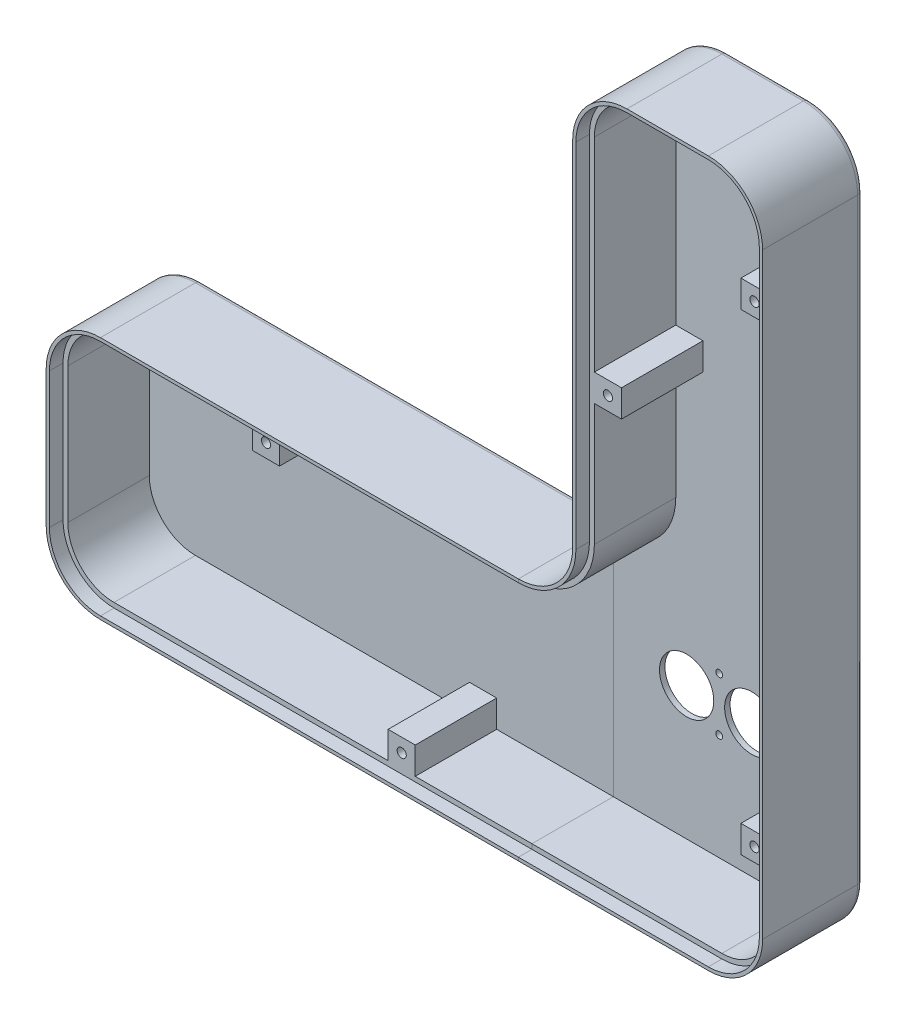
from build123d import *

# Parameters (mm, degrees)
BOX_EXTRUDE_DEPTH                 = 37
SHELL1_T                          = -1.2
SHELL1_THICKNESS_2_DEPTH          = 30.8
SHELL2_START                      = -35
SHELL2_DEPTH                      = 30
SKETCH2_W                         = 10
SKETCH2_H                         = 10
SQUARES_EXTRUDE_DEPTH             = 30
SQUARES_M3_CLEARANCE_HOLES_D      = 3.4
SQUARES_M3_CLEARANCE_HOLES_DEPTH  = 46
SQUARES_M3_CLEARANCE_HOLES_TIP    = 1.021463052
SKETCH5_R                         = 3
SQUARESCREWS_CUT_EXTRUDE_DEPTH    = 12
FILLET1_R                         = 2
DOVETAIL_M18_CLEARANCE_HOLE_D     = 20
DOVETAIL_M18_CLEARANCE_HOLE_DEPTH = 46
DOVETAIL_M18_CLEARANCE_HOLE_TIP   = 6.00860619
DOVETAIL_M3_CLEARANCE_HOLE_D      = 2.5
DOVETAIL_M3_CLEARANCE_HOLE_DEPTH  = 46
DOVETAIL_M3_CLEARANCE_HOLE_TIP    = 0.751075774


# Read off the part's stored shape, not the designer's step: Shell2
with BuildPart() as part:
    # Sketch1 → Box-Extrude (new body)
    with BuildSketch(Plane.XY):
        with BuildLine():
            Line((189.366428174, 55.055128635), (189.366428174, -25.682309997))
            ThreePointArc((189.366428174, -25.682309997), (183.508563798, -39.824445621), (169.366428174, -45.682309997))
            Line((169.366428174, -45.682309997), (0, -45.682309997))
            Line((0, -45.682309997), (-54.633571826, -45.682309997))
            ThreePointArc((-54.633571826, -45.682309997), (-68.77570745, -39.824445621), (-74.633571826, -25.682309997))
            Line((-74.633571826, -25.682309997), (-74.633571826, 24.317690003))
            ThreePointArc((-74.633571826, 24.317690003), (-68.77570745, 38.459825627), (-54.633571826, 44.317690003))
            Line((-54.633571826, 44.317690003), (99.366428174, 44.317690003))
            ThreePointArc((99.366428174, 44.317690003), (109.72858945, 47.211386671), (117.092255571, 55.055128635))
            ThreePointArc((117.092255571, 55.055128635), (118.789565767, 59.548861422), (119.366428174, 64.317690003))
            Line((119.366428174, 64.317690003), (119.366428174, 194.317690003))
            ThreePointArc((119.366428174, 194.317690003), (125.22429255, 208.459825627), (139.366428174, 214.317690003))
            Line((139.366428174, 214.317690003), (169.366428174, 214.317690003))
            ThreePointArc((169.366428174, 214.317690003), (183.508563798, 208.459825627), (189.366428174, 194.317690003))
            Line((189.366428174, 194.317690003), (189.366428174, 55.055128635))
        make_face()
    extrude(amount=-BOX_EXTRUDE_DEPTH)

    # Shell1
    shell1_openings = [part.faces().sort_by_distance(p)[0] for p in [
        (90.029023859, 42.316719336, 0),
    ]]
    offset(amount=SHELL1_T, openings=shell1_openings, kind=Kind.INTERSECTION)

    # Shell1 thickness 2 face (on inner face of the shell) → Shell1 thickness 2 (add)
    with BuildSketch(Plane(origin=(90.047419114, 41.98561552, -35.8), x_dir=(-1, 0, 0), z_dir=(0, 0, -1))):
        with BuildLine():
            Line((-9.31900906, 1.132074483), (144.68099094, 1.132074483))
            ThreePointArc((144.68099094, 1.132074483), (157.974598426, -4.374318031), (163.48099094, -17.667925517))
            Line((163.48099094, -17.667925517), (163.48099094, -67.667925517))
            ThreePointArc((163.48099094, -67.667925517), (157.974598426, -80.961533003), (144.68099094, -86.467925517))
            Line((144.68099094, -86.467925517), (-79.31900906, -86.467925517))
            ThreePointArc((-79.31900906, -86.467925517), (-92.612616546, -80.961533003), (-98.11900906, -67.667925517))
            Line((-98.11900906, -67.667925517), (-98.11900906, 152.332074483))
            ThreePointArc((-98.11900906, 152.332074483), (-92.612616546, 165.625681969), (-79.31900906, 171.132074483))
            Line((-79.31900906, 171.132074483), (-49.31900906, 171.132074483))
            ThreePointArc((-49.31900906, 171.132074483), (-36.025401574, 165.625681969), (-30.51900906, 152.332074483))
            Line((-30.51900906, 152.332074483), (-30.51900906, 22.332074483))
            ThreePointArc((-30.51900906, 22.332074483), (-24.309672821, 7.341410722), (-9.31900906, 1.132074483))
        make_face()
    extrude(amount=-SHELL1_THICKNESS_2_DEPTH)

    # Shell2 outline → Shell2 (cut)
    with BuildSketch(Plane.XY.offset(SHELL2_START)):
        with BuildLine():
            Line((-54.633571826, -42.682309997), (169.366428174, -42.682309997))
            ThreePointArc((169.366428174, -42.682309997), (181.387243454, -37.703125277), (186.366428174, -25.682309997))
            Line((186.366428174, -25.682309997), (186.366428174, 194.317690003))
            ThreePointArc((186.366428174, 194.317690003), (181.387243454, 206.338505283), (169.366428174, 211.317690003))
            Line((169.366428174, 211.317690003), (139.366428174, 211.317690003))
            ThreePointArc((139.366428174, 211.317690003), (127.345612894, 206.338505283), (122.366428174, 194.317690003))
            Line((122.366428174, 194.317690003), (122.366428174, 64.317690003))
            ThreePointArc((122.366428174, 64.317690003), (115.629884141, 48.054234036), (99.366428174, 41.317690003))
            Line((99.366428174, 41.317690003), (-54.633571826, 41.317690003))
            ThreePointArc((-54.633571826, 41.317690003), (-66.654387106, 36.338505283), (-71.633571826, 24.317690003))
            Line((-71.633571826, 24.317690003), (-71.633571826, -25.682309997))
            ThreePointArc((-71.633571826, -25.682309997), (-66.654387106, -37.703125277), (-54.633571826, -42.682309997))
        make_face()
    extrude(amount=SHELL2_DEPTH, mode=Mode.SUBTRACT)

    # Sketch2 → Squares-Extrude (add)
    with BuildSketch(Plane.XY.offset(-35)):
        with Locations((1.366428174, 36.317690003)):
            Rectangle(SKETCH2_W, SKETCH2_H)
        with Locations((127.366428174, 114.317690003)):
            Rectangle(SKETCH2_W, SKETCH2_H)
        with Locations((51.366428174, -37.682309997)):
            Rectangle(SKETCH2_W, SKETCH2_H)
        with Locations((181.366428174, -2.682309997)):
            Rectangle(SKETCH2_W, SKETCH2_H)
        with Locations((181.366428174, 171.317690003)):
            Rectangle(SKETCH2_W, SKETCH2_H)
    extrude(amount=SQUARES_EXTRUDE_DEPTH)

    # Squares M3 Clearance Holes
    with Locations(Plane(origin=(0, 0, -4.5), x_dir=(-1, 0, 0), z_dir=(0, 0, 1))):
        with Locations((-51.366428174, 37.682309997), (-1.366428174, -36.317690003), (-181.366428174, 2.682309997), (-127.366428174, -114.317690003), (-181.366428174, -171.317690003)):
            Hole(SQUARES_M3_CLEARANCE_HOLES_D / 2, depth=SQUARES_M3_CLEARANCE_HOLES_DEPTH)
            with Locations((0, 0, -(SQUARES_M3_CLEARANCE_HOLES_DEPTH + SQUARES_M3_CLEARANCE_HOLES_TIP / 2))):  # 118° drill point
                Cone(0, SQUARES_M3_CLEARANCE_HOLES_D / 2, SQUARES_M3_CLEARANCE_HOLES_TIP, mode=Mode.SUBTRACT)

    # Sketch5 → SquareScrews Cut-Extrude (cut)
    with BuildSketch(Plane(origin=(0, 0, -37), x_dir=(-1, 0, 0), z_dir=(0, 0, -1))):
        with Locations((-181.366428174, 171.317690003)):
            Circle(SKETCH5_R)
        with Locations((-181.366428174, -2.682309997)):
            Circle(SKETCH5_R)
        with Locations((-51.366428174, -37.682309997)):
            Circle(SKETCH5_R)
        with Locations((-1.366428174, 36.317690003)):
            Circle(SKETCH5_R)
        with Locations((-127.366428174, 114.317690003)):
            Circle(SKETCH5_R)
    extrude(amount=-SQUARESCREWS_CUT_EXTRUDE_DEPTH, mode=Mode.SUBTRACT)

    # Fillet1
    fillet1_edges = [part.edges().sort_by_distance(p)[0] for p in [
        (183.508563798, 208.459825627, -37),
        (154.366428174, 214.317690003, -37),
        (125.22429255, 208.459825627, -37),
        (119.366428174, 129.317690003, -37),
        (113.508563798, 50.175554379, -37),
        (22.366428174, 44.317690003, -37),
        (-68.77570745, 38.459825627, -37),
        (-74.633571826, -0.682309997, -37),
        (183.508563798, -39.824445621, -37),
        (-68.77570745, -39.824445621, -37),
        (57.366428174, -45.682309997, -37),
        (189.366428174, 84.317690003, -37),
    ]]
    fillet(fillet1_edges, radius=FILLET1_R)

    # Dovetail M18 Clearance Hole
    with Locations(Plane.XY.offset(-35)):
        with Locations((126.366428174, 6.317690003), (150.366428174, 6.317690003)):
            Hole(DOVETAIL_M18_CLEARANCE_HOLE_D / 2, depth=DOVETAIL_M18_CLEARANCE_HOLE_DEPTH)
            with Locations((0, 0, -(DOVETAIL_M18_CLEARANCE_HOLE_DEPTH + DOVETAIL_M18_CLEARANCE_HOLE_TIP / 2))):  # 118° drill point
                Cone(0, DOVETAIL_M18_CLEARANCE_HOLE_D / 2, DOVETAIL_M18_CLEARANCE_HOLE_TIP, mode=Mode.SUBTRACT)

    # Dovetail M3 Clearance Hole
    with Locations(Plane(origin=(0, 0, -37), x_dir=(1, 0, 0), z_dir=(0, 0, -1))):
        with Locations((138.366428174, 3.507309997), (138.366428174, -16.142690003)):
            Hole(DOVETAIL_M3_CLEARANCE_HOLE_D / 2, depth=DOVETAIL_M3_CLEARANCE_HOLE_DEPTH)
            with Locations((0, 0, -(DOVETAIL_M3_CLEARANCE_HOLE_DEPTH + DOVETAIL_M3_CLEARANCE_HOLE_TIP / 2))):  # 118° drill point
                Cone(0, DOVETAIL_M3_CLEARANCE_HOLE_D / 2, DOVETAIL_M3_CLEARANCE_HOLE_TIP, mode=Mode.SUBTRACT)


with BuildPart() as body_2:
    # Split1: the piece on the far side of the plane
    add(part.part)
    split(bisect_by=Plane(origin=(99.366428174, 0, 0), x_dir=(0, 0, 1), z_dir=(1, 0, 0)), keep=Keep.BOTTOM)


with BuildPart() as part_1:
    add(part.part)

    # Split1
    split(bisect_by=Plane(origin=(99.366428174, 0, 0), x_dir=(0, 0, 1), z_dir=(1, 0, 0)), keep=Keep.TOP)


solid = Compound([body_2.part, part_1.part])
